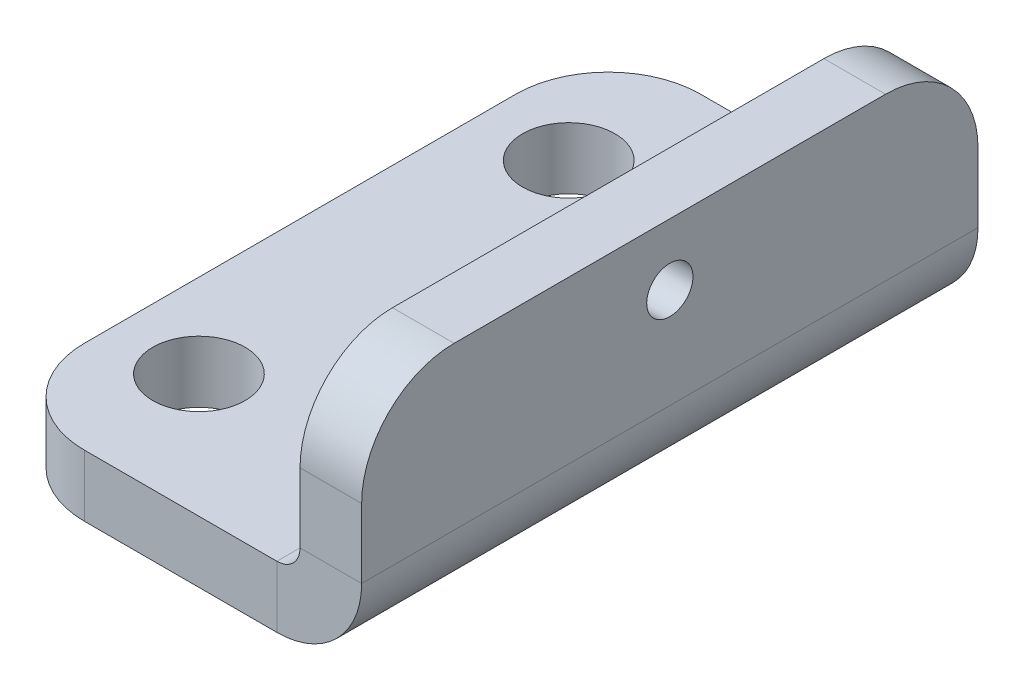
from build123d import *

# Parameters (mm, degrees)
SKETCH1_R                    = 1.5
BASE_FLANGE1_DEPTH           = 2
EDGE_FLANGE1_STRIP_W         = 9.5
EDGE_FLANGE1_STRIP_H         = 2
EDGE_FLANGE1_STRIP_CUT_DEPTH = 20
EDGE_FLANGE1_DEPTH           = 20
SKETCH9_R                    = 0.75
CUT_EXTRUDE1_DEPTH           = 10
FILLET1_R                    = 3
L_EK1_SCALE                  = 2


# Sheet-metal steps are written as plain solids
with BuildPart() as part:
    # Sketch1 → Base-Flange1 (new body)
    with BuildSketch(Plane(origin=(0, 0, 0), x_dir=(1, 0, 0), z_dir=(0, 1, 0))):
        with BuildLine():
            Line((0, 7), (0, -7))
            ThreePointArc((0, -7), (0.878679656, -9.121320344), (3, -10))
            Line((3, -10), (12, -10))
            Line((12, -10), (12, 10))
            Line((12, 10), (3, 10))
            ThreePointArc((3, 10), (0.878679656, 9.121320344), (0, 7))
        make_face()
        with Locations(Location((2.72, 6, 0), (0, 0, 270))):
            Circle(SKETCH1_R, mode=Mode.SUBTRACT)
        with Locations(Location((2.72, -6, 0), (0, 0, 270))):
            Circle(SKETCH1_R, mode=Mode.SUBTRACT)
    extrude(amount=BASE_FLANGE1_DEPTH)

    # Edge-Flange1 strip (across the edge) → Edge-Flange1 strip cut (cut)
    with BuildSketch(Plane(origin=(12, 2, 10), x_dir=(-1, 0, 0), z_dir=(0, 0, -1))):
        with Locations((-2, -1)):
            Rectangle(EDGE_FLANGE1_STRIP_W, EDGE_FLANGE1_STRIP_H)
    extrude(amount=EDGE_FLANGE1_STRIP_CUT_DEPTH, mode=Mode.SUBTRACT)

    # Edge-Flange1 section (across the edge) → Edge-Flange1 (add)
    with BuildSketch(Plane(origin=(12, 2, 10), x_dir=(-1, 0, 0), z_dir=(0, 0, -1))):
        with BuildLine():
            Line((0, 0.75), (0, 6))
            Line((0, 6), (2, 6))
            Line((2, 6), (2, 0.75))
            ThreePointArc((2, 0.75), (2.219669914, 0.219669914), (2.75, 0))
            Line((2.75, 0), (2.75, -2))
            ThreePointArc((2.75, -2), (0.805456352, -1.194543648), (0, 0.75))
        make_face()
    extrude(amount=EDGE_FLANGE1_DEPTH)

    # Sketch9 → Cut-Extrude1 (cut)
    with BuildSketch(Plane.ZY.offset(-10)):
        with Locations(Location((0, 6, 0), (0, 0, 270))):
            Circle(SKETCH9_R)
    extrude(amount=-CUT_EXTRUDE1_DEPTH, mode=Mode.SUBTRACT)

    # Fillet1
    fillet1_edges = [part.edges().sort_by_distance(p)[0] for p in [
        (11, 8, 10),
        (11, 8, -10),
    ]]
    fillet(fillet1_edges, radius=FILLET1_R)


with BuildPart() as part_1:
    # Ölçek1: scaled about (7.730300008, 2.413989503, 0)
    add(part.part.scale(L_EK1_SCALE).moved(Location((-7.730300008, -2.413989503, 0))))


solid = part_1.part
